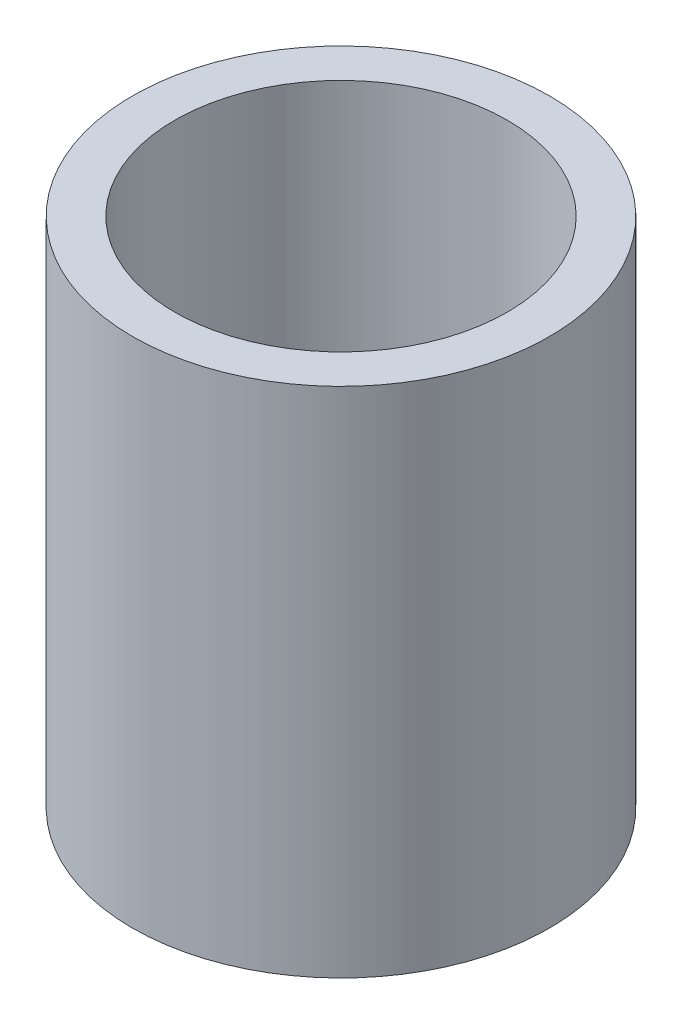
from build123d import *

# Parameters (mm, degrees)
SKETCH1_R           = 32.5
BOSS_EXTRUDE1_DEPTH = 79.880726664
SKETCH2_R           = 25.928130456
CUT_EXTRUDE1_DEPTH  = 93.159809529


with BuildPart() as part:
    # Sketch1 → Boss-Extrude1 (new body)
    with BuildSketch(Plane(origin=(0, 0, 0), x_dir=(1, 0, 0), z_dir=(0, 1, 0))):
        Circle(SKETCH1_R)
    extrude(amount=BOSS_EXTRUDE1_DEPTH)

    # Sketch2 → Cut-Extrude1 (cut, through all)
    with BuildSketch(Plane(origin=(0, 0, 0), x_dir=(1, 0, 0), z_dir=(0, 1, 0))):
        Circle(SKETCH2_R)
    extrude(amount=CUT_EXTRUDE1_DEPTH, mode=Mode.SUBTRACT)


solid = part.part
